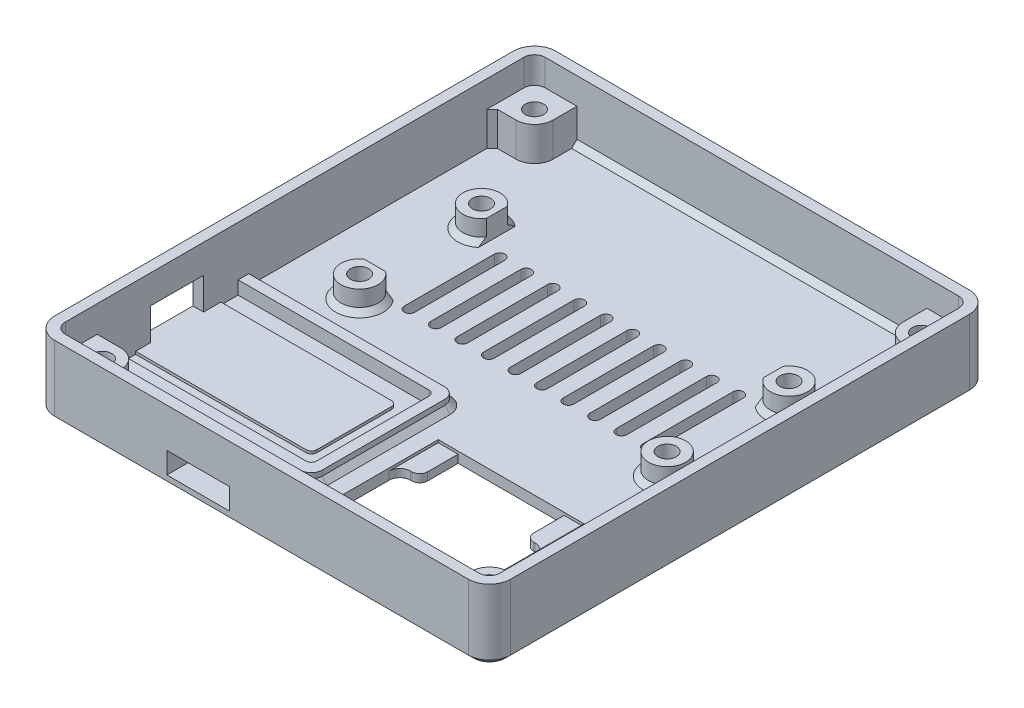
from build123d import *

# Parameters (mm, degrees)
BOSS_EXTRUDE1_DEPTH                               = 13.4
BOSS_EXTRUDE2_DEPTH                               = 2
SKETCH4_R                                         = 3.5
BOSS_EXTRUDE3_DEPTH                               = 4
CSK_FOR_4_FLAT_HEAD_SOCKET_CAP_SCREW1_D           = 3.4544
CSK_FOR_4_FLAT_HEAD_SOCKET_CAP_SCREW1_CSINK_D     = 6.7237356
CSK_FOR_4_FLAT_HEAD_SOCKET_CAP_SCREW1_CSINK_ANGLE = 82
BOSS_EXTRUDE5_DEPTH                               = 2
FILLET1_R                                         = 1
FILLET2_R                                         = 1
FILLET3_R                                         = 2
CUT_EXTRUDE4_REACH                                = 106.02
SKETCH16_W                                        = 10
SKETCH16_H                                        = 6
BOSS_EXTRUDE4_DEPTH                               = 6.4
CHAMFER1_SIZE                                     = 1
CHAMFER2_SIZE                                     = 1
CHAMFER3_SIZE                                     = 1
CUT_EXTRUDE2_REACH                                = 100.155
CUT_EXTRUDE6_DEPTH                                = 2
CUT_EXTRUDE6_DEPTH_BACK                           = 172.566325831
SKETCH19_W                                        = 11.8
SKETCH19_H                                        = 4
CUT_EXTRUDE8_DEPTH                                = 0.5
BOSS_EXTRUDE7_DEPTH                               = 2
CSK_FOR_4_FLAT_HEAD_SOCKET_CAP_SCREW2_D           = 3.4544
CSK_FOR_4_FLAT_HEAD_SOCKET_CAP_SCREW2_CSINK_D     = 6.723761
CSK_FOR_4_FLAT_HEAD_SOCKET_CAP_SCREW2_CSINK_ANGLE = 82
SKETCH26_W                                        = 27.5
SKETCH26_H                                        = 27.5
CUT_EXTRUDE9_DEPTH                                = 0.5
CUT_EXTRUDE10_DEPTH                               = 98.961449883


with BuildPart() as part:
    # Sketch2 → Boss-Extrude1 (new body)
    with BuildSketch(Plane(origin=(0, 0, 0), x_dir=(1, 0, 0), z_dir=(0, 1, 0))):
        with BuildLine():
            Line((-76.616981764, 30.627854819), (-76.616981764, -1.622145181))
            Line((-76.616981764, -1.622145181), (-76.616981764, -55.872145181))
            ThreePointArc((-76.616981764, -55.872145181), (-75.445408889, -58.700572306), (-72.616981764, -59.872145181))
            Line((-72.616981764, -59.872145181), (5.383018236, -59.872145181))
            ThreePointArc((5.383018236, -59.872145181), (8.211445361, -58.700572306), (9.383018236, -55.872145181))
            Line((9.383018236, -55.872145181), (9.383018236, -1.622145181))
            Line((9.383018236, -1.622145181), (9.383018236, 30.627854819))
            ThreePointArc((9.383018236, 30.627854819), (8.211445361, 33.456281944), (5.383018236, 34.627854819))
            Line((5.383018236, 34.627854819), (-72.616981764, 34.627854819))
            ThreePointArc((-72.616981764, 34.627854819), (-75.445408889, 33.456281944), (-76.616981764, 30.627854819))
        make_face()
        with BuildLine():
            Line((-74.616981764, -16.372145181), (-74.616981764, 13.627854819))
            Line((-74.616981764, 13.627854819), (-74.616981764, 30.627854819))
            ThreePointArc((-74.616981764, 30.627854819), (-74.031195326, 32.042068381), (-72.616981764, 32.627854819))
            Line((-72.616981764, 32.627854819), (5.383018236, 32.627854819))
            ThreePointArc((5.383018236, 32.627854819), (6.797231798, 32.042068381), (7.383018236, 30.627854819))
            Line((7.383018236, 30.627854819), (7.383018236, -55.872145181))
            ThreePointArc((7.383018236, -55.872145181), (6.797231798, -57.286358744), (5.383018236, -57.872145181))
            Line((5.383018236, -57.872145181), (-72.616981764, -57.872145181))
            ThreePointArc((-72.616981764, -57.872145181), (-74.031195326, -57.286358744), (-74.616981764, -55.872145181))
            Line((-74.616981764, -55.872145181), (-74.616981764, -16.372145181))
        make_face(mode=Mode.SUBTRACT)
    extrude(amount=BOSS_EXTRUDE1_DEPTH)

    # Sketch2<3> → Boss-Extrude2 (add)
    with BuildSketch(Plane(origin=(0, 0, 0), x_dir=(1, 0, 0), z_dir=(0, 1, 0))):
        with BuildLine():
            Line((-72.616981764, 32.627854819), (5.383018236, 32.627854819))
            ThreePointArc((5.383018236, 32.627854819), (6.797231798, 32.042068381), (7.383018236, 30.627854819))
            Line((7.383018236, 30.627854819), (7.383018236, -55.872145181))
            ThreePointArc((7.383018236, -55.872145181), (6.797231798, -57.286358744), (5.383018236, -57.872145181))
            Line((5.383018236, -57.872145181), (-72.616981764, -57.872145181))
            ThreePointArc((-72.616981764, -57.872145181), (-74.031195326, -57.286358744), (-74.616981764, -55.872145181))
            Line((-74.616981764, -55.872145181), (-74.616981764, 30.627854819))
            ThreePointArc((-74.616981764, 30.627854819), (-74.031195326, 32.042068381), (-72.616981764, 32.627854819))
        make_face()
    extrude(amount=BOSS_EXTRUDE2_DEPTH)

    # Sketch4 → Boss-Extrude3 (add)
    with BuildSketch(Plane(origin=(0, 2, 0), x_dir=(1, 0, 0), z_dir=(0, 1, 0))):
        with BuildLine():
            Line((-7.082532008, 11.986755501), (-7.082532008, 8.268954136))
            ThreePointArc((-7.082532008, 8.268954136), (-0.616981764, 10.127854819), (-7.082532008, 11.986755501))
        make_face()
        with BuildLine():
            Line((-59.234341769, 8.142814098), (-59.234341769, 12.112895539))
            ThreePointArc((-59.234341769, 12.112895539), (-63.156395065, 13.469952961), (-65.616981764, 10.127854819))
            ThreePointArc((-65.616981764, 10.127854819), (-63.156395065, 6.785756677), (-59.234341769, 8.142814098))
        make_face()
        with BuildLine():
            Line((-64.139653984, -10.015784368), (-60.094309544, -10.015784368))
            ThreePointArc((-60.094309544, -10.015784368), (-62.116981764, -16.372145181), (-64.139653984, -10.015784368))
        make_face()
        with Locations(Location((-4.116981764, -12.872145181, 0), (0, 0, 90))):
            Circle(SKETCH4_R)
    extrude(amount=BOSS_EXTRUDE3_DEPTH)

    # CSK for #4 Flat Head Socket Cap Screw1 (through all)
    with Locations(Plane(origin=(0, 0, 0), x_dir=(-1, 0, 0), z_dir=(0, -1, 0))):
        with Locations((4.116981764, 10.127854819), (62.116981764, 10.127854819), (4.116981764, -12.872145181), (62.116981764, -12.872145181)):
            CounterSinkHole(CSK_FOR_4_FLAT_HEAD_SOCKET_CAP_SCREW1_D / 2, CSK_FOR_4_FLAT_HEAD_SOCKET_CAP_SCREW1_CSINK_D / 2, counter_sink_angle=CSK_FOR_4_FLAT_HEAD_SOCKET_CAP_SCREW1_CSINK_ANGLE)

    # Sketch15 → Boss-Extrude5 (add)
    with BuildSketch(Plane(origin=(0, 2, 0), x_dir=(1, 0, 0), z_dir=(0, 1, 0))):
        Polygon((-74.616981764, -23.279023477), (-37.616981764, -23.279023477), (-37.616981764, -46.479023477), (-74.616981764, -46.479023477), (-74.616981764, -48.479023477), (-35.616981764, -48.479023477), (-35.616981764, -21.279023477), (-74.616981764, -21.279023477), align=None)
    extrude(amount=BOSS_EXTRUDE5_DEPTH)

    # Fillet1
    fillet1_edges = [part.edges().sort_by_distance(p)[0] for p in [
        (-37.616981764, 3, 23.279023477),
    ]]
    fillet(fillet1_edges, radius=FILLET1_R)

    # Fillet2
    fillet2_edges = [part.edges().sort_by_distance(p)[0] for p in [
        (-37.616981764, 3, 46.479023477),
    ]]
    fillet(fillet2_edges, radius=FILLET2_R)

    # Fillet3
    fillet3_edges = [part.edges().sort_by_distance(p)[0] for p in [
        (-35.616981764, 3, 48.479023477),
        (-35.616981764, 3, 21.279023477),
    ]]
    fillet(fillet3_edges, radius=FILLET3_R)

    # Sketch16 → Cut-Extrude4 (cut, up to next)
    with BuildSketch(Plane(origin=(-74.616981764, 0, 0), x_dir=(0, 0, -1), z_dir=(1, 0, 0)), mode=Mode.PRIVATE) as cut_extrude4_sk1:
        with Locations((-34.805263249, 5)):
            Rectangle(SKETCH16_W, SKETCH16_H)
    cut_extrude4_tool1 = extrude(cut_extrude4_sk1.sketch, amount=-CUT_EXTRUDE4_REACH, mode=Mode.PRIVATE) & part.part
    add(cut_extrude4_tool1.solids().sort_by_distance((-74.616982, 5, 34.805263))[0], mode=Mode.SUBTRACT)


with BuildPart() as boss_extrude4_tool:
    # Sketch9 → Boss-Extrude4 (new body)
    with BuildSketch(Plane(origin=(0, 2, 0), x_dir=(1, 0, 0), z_dir=(0, 1, 0))):
        with BuildLine():
            Line((2.883018236, -49.872145181), (7.383018236, -49.872145181))
            Line((7.383018236, -49.872145181), (7.383018236, -55.872145181))
            ThreePointArc((7.383018236, -55.872145181), (6.797231798, -57.286358744), (5.383018236, -57.872145181))
            Line((5.383018236, -57.872145181), (-0.616981764, -57.872145181))
            Line((-0.616981764, -57.872145181), (-0.616981764, -53.372145181))
            ThreePointArc((-0.616981764, -53.372145181), (0.408144502, -50.897271447), (2.883018236, -49.872145181))
        make_face()
        with BuildLine():
            Line((-0.616981764, 32.627854819), (5.383018236, 32.627854819))
            ThreePointArc((5.383018236, 32.627854819), (6.798375575, 32.040923679), (7.383015617, 30.624618423))
            Line((7.383015617, 30.624618423), (7.373311655, 24.627854819))
            Line((7.373311655, 24.627854819), (2.883018236, 24.627854819))
            ThreePointArc((2.883018236, 24.627854819), (0.408144502, 25.652981085), (-0.616981764, 28.127854819))
            Line((-0.616981764, 28.127854819), (-0.616981764, 32.627854819))
        make_face()
        with BuildLine():
            Line((-66.616981764, 32.627854819), (-72.616981764, 32.627854819))
            ThreePointArc((-72.616981764, 32.627854819), (-74.031195326, 32.042068381), (-74.616981764, 30.627854819))
            Line((-74.616981764, 30.627854819), (-74.616981764, 24.627854819))
            Line((-74.616981764, 24.627854819), (-70.116981764, 24.627854819))
            ThreePointArc((-70.116981764, 24.627854819), (-67.64210803, 25.652981085), (-66.616981764, 28.127854819))
            Line((-66.616981764, 28.127854819), (-66.616981764, 32.627854819))
        make_face()
        with BuildLine():
            Line((-66.616981764, -53.372145181), (-66.616981764, -57.872145181))
            Line((-66.616981764, -57.872145181), (-72.616981764, -57.872145181))
            ThreePointArc((-72.616981764, -57.872145181), (-74.032339103, -57.285214042), (-74.616979145, -55.868908785))
            Line((-74.616979145, -55.868908785), (-74.607275183, -49.872145181))
            Line((-74.607275183, -49.872145181), (-70.116981764, -49.872145181))
            ThreePointArc((-70.116981764, -49.872145181), (-67.64210803, -50.897271447), (-66.616981764, -53.372145181))
        make_face()
    extrude(amount=BOSS_EXTRUDE4_DEPTH)


with BuildPart() as part_1:
    add(part.part)


with BuildPart() as part_2:
    # Boss-Extrude4: joined with boss_extrude4_tool
    add(part_1.part.fuse(boss_extrude4_tool.part, tol=0.00001))

    # Chamfer1
    chamfer1_edges = [part_2.edges().sort_by_distance(p)[0] for p in [
        (-0.616981764, 5.2, 57.872145181),
        (7.383018236, 5.2, 49.872145181),
        (-74.616981764, 5.2, -24.627854819),
        (-66.616981764, 5.2, 57.872145181),
    ]]
    chamfer(chamfer1_edges, length=CHAMFER1_SIZE)

    # Chamfer2
    # the kernel refuses this chamfer: 1 mm, written as the material it adds along each edge
    with BuildSketch(Plane(origin=(-62.116981764, 2, 12.872145181), x_dir=(0.003141587485879022, 0, -0.9999950652018582), z_dir=(-0.9999950652018582, 0, -0.003141587485879022))) as chamfer2_piece_1_section:
        Polygon((3.5, -CHAMFER2_SIZE), (3.5 + CHAMFER2_SIZE, 0), (3.5, 0), align=None)
    chamfer2_piece_1 = revolve(axis=Axis((-62.116981764, 2, 12.872145181), (0, -1, 0)), revolution_arc=359.64, mode=Mode.PRIVATE)
    chamfer2_piece_1 = split(chamfer2_piece_1, bisect_by=Plane(origin=(-62.116981764, 2, 10.015784368), z_dir=(0, 0, 1)), keep=Keep.TOP, mode=Mode.PRIVATE)
    add(chamfer2_piece_1)
    with BuildSketch(Plane(origin=(-62.116981764, 2, -10.127854819), x_dir=(0.9999950652018582, 0, -0.0031415874858785257), z_dir=(0.0031415874858785257, 0, 0.9999950652018582))) as chamfer2_piece_2_section:
        Polygon((3.5, CHAMFER2_SIZE), (3.5 + CHAMFER2_SIZE, 0), (3.5, 0), align=None)
    chamfer2_piece_2 = revolve(axis=Axis((-62.116981764, 2, -10.127854819), (0, 1, 0)), revolution_arc=359.64, mode=Mode.PRIVATE)
    chamfer2_piece_2 = split(chamfer2_piece_2, bisect_by=Plane(origin=(-59.234341769, 2, -10.127854819), z_dir=(-1, 0, 0)), keep=Keep.TOP, mode=Mode.PRIVATE)
    add(chamfer2_piece_2)
    with BuildSketch(Plane(origin=(7.383018236, 2, -33.196301411), x_dir=(0, 1, 0), z_dir=(0, 0, 1))) as chamfer2_piece_3:
        Polygon((CHAMFER2_SIZE, 0), (0, CHAMFER2_SIZE), (0, 0), align=None)
    extrude(amount=84.64012958)
    with BuildSketch(Plane(origin=(-69.188664752, 2, -32.627854819), x_dir=(0, 1, 0), z_dir=(1, 0, 0))) as chamfer2_piece_4:
        Polygon((CHAMFER2_SIZE, 0), (0, CHAMFER2_SIZE), (0, 0), align=None)
    extrude(amount=71.143365976)
    with BuildSketch(Plane(origin=(0.954701224, 2, 57.872145181), x_dir=(0, 1, 0), z_dir=(-1, 0, 0))) as chamfer2_piece_5:
        Polygon((CHAMFER2_SIZE, 0), (0, CHAMFER2_SIZE), (0, 0), align=None)
    extrude(amount=69.143365976)
    with BuildSketch(Plane(origin=(-4.116981764, 2, -10.127854819), x_dir=(-0.9999950652018582, 0, 0.003141587485879529), z_dir=(-0.003141587485879529, 0, -0.9999950652018582))) as chamfer2_piece_6_section:
        Polygon((3.5, CHAMFER2_SIZE), (3.5 + CHAMFER2_SIZE, 0), (3.5, 0), align=None)
    chamfer2_piece_6 = revolve(axis=Axis((-4.116981764, 2, -10.127854819), (0, 1, 0)), revolution_arc=359.64, mode=Mode.PRIVATE)
    chamfer2_piece_6 = split(chamfer2_piece_6, bisect_by=Plane(origin=(-7.082532008, 2, -10.127854819), z_dir=(1, 0, 0)), keep=Keep.TOP, mode=Mode.PRIVATE)
    add(chamfer2_piece_6)
    with BuildSketch(Plane(origin=(-0.616981764, 2, 59.443828169), x_dir=(0, 1, 0), z_dir=(0, 0, -1)), Plane(origin=(2.883018236, 2, 49.872145181), x_dir=(0, 1, 0), z_dir=(1, 0, 0))) as chamfer2_piece_7:
        Polygon((CHAMFER2_SIZE, 0), (0, -CHAMFER2_SIZE), (0, 0), align=None)
    extrude(amount=6.071682988)
    with BuildSketch(Plane(origin=(2.883018236, 2, 53.372145181), x_dir=(-1, 0, 0), z_dir=(0, 0, 1))) as chamfer2_piece_8:
        Polygon((3.5, -CHAMFER2_SIZE), (3.5 + CHAMFER2_SIZE, 0), (3.5, 0), align=None)
    revolve(axis=Axis((2.883018236, 2, 53.372145181), (0, -1, 0)), revolution_arc=90)
    with BuildSketch(Plane(origin=(-4.116981764, 2, 12.872145181), x_dir=(0, 0, -1), z_dir=(1, 0, 0))) as chamfer2_piece_9:
        Polygon((3.5, CHAMFER2_SIZE), (3.5 + CHAMFER2_SIZE, 0), (3.5, 0), align=None)
    revolve(axis=Axis((-4.116981764, 2, 12.872145181), (0, 1, 0)))
    with BuildSketch(Plane(origin=(-77.188664752, 2, 48.479023477), x_dir=(0, 1, 0), z_dir=(1, 0, 0))) as chamfer2_piece_10_section:
        Polygon((CHAMFER2_SIZE, 0), (0, CHAMFER2_SIZE), (0, 0), align=None)
    chamfer2_piece_10 = extrude(amount=39.571682988, mode=Mode.PRIVATE)
    chamfer2_piece_10 = split(chamfer2_piece_10, bisect_by=Plane(origin=(-76.616981764, 2, 48.479023477), z_dir=(1, 0, 0)), keep=Keep.TOP, mode=Mode.PRIVATE)
    add(chamfer2_piece_10)
    with BuildSketch(Plane(origin=(-37.616981764, 2, 21.279023477), x_dir=(0, 1, 0), z_dir=(-1, 0, 0))) as chamfer2_piece_11_section:
        Polygon((CHAMFER2_SIZE, 0), (0, CHAMFER2_SIZE), (0, 0), align=None)
    chamfer2_piece_11 = extrude(amount=39.571682988, mode=Mode.PRIVATE)
    chamfer2_piece_11 = split(chamfer2_piece_11, bisect_by=Plane(origin=(-76.616981764, 2, 21.279023477), z_dir=(1, 0, 0)), keep=Keep.TOP, mode=Mode.PRIVATE)
    add(chamfer2_piece_11)
    with BuildSketch(Plane(origin=(-37.616981764, 2, 46.479023477), x_dir=(0, 0, 1), z_dir=(-1, 0, 0))) as chamfer2_piece_12:
        Polygon((2, CHAMFER2_SIZE), (2 + CHAMFER2_SIZE, 0), (2, 0), align=None)
    revolve(axis=Axis((-37.616981764, 2, 46.479023477), (0, 1, 0)), revolution_arc=90)
    with BuildSketch(Plane(origin=(-37.616981764, 2, 23.279023477), x_dir=(0, 0, -1), z_dir=(-1, 0, 0))) as chamfer2_piece_13:
        Polygon((2, -CHAMFER2_SIZE), (2 + CHAMFER2_SIZE, 0), (2, 0), align=None)
    revolve(axis=Axis((-37.616981764, 2, 23.279023477), (0, -1, 0)), revolution_arc=90)
    with BuildSketch(Plane(origin=(-35.616981764, 2, 46.479023477), x_dir=(0, 1, 0), z_dir=(0, 0, -1))) as chamfer2_piece_14:
        Polygon((CHAMFER2_SIZE, 0), (0, CHAMFER2_SIZE), (0, 0), align=None)
    extrude(amount=23.2)

    # Chamfer3
    chamfer3_edges = [part_2.edges().sort_by_distance(p)[0] for p in [
        (8.211445361, 0, 58.700572306),
        (-75.445408889, 0, 58.700572306),
        (8.211445361, 0, -33.456281944),
        (-76.616981764, 0, 12.622145181),
        (-75.445408889, 0, -33.456281944),
        (-33.616981764, 0, -34.627854819),
    ]]
    chamfer(chamfer3_edges, length=CHAMFER3_SIZE)

    # Sketch12 → Cut-Extrude2 (cut, up to next)
    with BuildSketch(Plane.XZ, mode=Mode.PRIVATE) as cut_extrude2_sk1:
        with BuildLine():
            Line((-54.660539895, 9.911346827), (-54.660539895, -7.088653173))
            ThreePointArc((-54.660539895, -7.088653173), (-55.660539895, -8.088653173), (-56.660539895, -7.088653173))
            Line((-56.660539895, -7.088653173), (-56.660539895, 9.911346827))
            ThreePointArc((-56.660539895, 9.911346827), (-55.660539895, 10.911346827), (-54.660539895, 9.911346827))
        make_face()
    cut_extrude2_tool1 = extrude(cut_extrude2_sk1.sketch, amount=-CUT_EXTRUDE2_REACH, mode=Mode.PRIVATE) & part_2.part
    # Sketch12 → Cut-Extrude2 (cut, up to next)
    with BuildSketch(Plane.XZ, mode=Mode.PRIVATE) as cut_extrude2_sk2:
        with BuildLine():
            Line((-49.660539895, 9.911346827), (-49.660539895, -7.088653173))
            ThreePointArc((-49.660539895, -7.088653173), (-50.660539895, -8.088653173), (-51.660539895, -7.088653173))
            Line((-51.660539895, -7.088653173), (-51.660539895, 9.911346827))
            ThreePointArc((-51.660539895, 9.911346827), (-50.660539895, 10.911346827), (-49.660539895, 9.911346827))
        make_face()
    cut_extrude2_tool2 = extrude(cut_extrude2_sk2.sketch, amount=-CUT_EXTRUDE2_REACH, mode=Mode.PRIVATE) & part_2.part
    # Sketch12 → Cut-Extrude2 (cut, up to next)
    with BuildSketch(Plane.XZ, mode=Mode.PRIVATE) as cut_extrude2_sk3:
        with BuildLine():
            Line((-44.660539895, 9.911346827), (-44.660539895, -7.088653173))
            ThreePointArc((-44.660539895, -7.088653173), (-45.660539895, -8.088653173), (-46.660539895, -7.088653173))
            Line((-46.660539895, -7.088653173), (-46.660539895, 9.911346827))
            ThreePointArc((-46.660539895, 9.911346827), (-45.660539895, 10.911346827), (-44.660539895, 9.911346827))
        make_face()
    cut_extrude2_tool3 = extrude(cut_extrude2_sk3.sketch, amount=-CUT_EXTRUDE2_REACH, mode=Mode.PRIVATE) & part_2.part
    # Sketch12 → Cut-Extrude2 (cut, up to next)
    with BuildSketch(Plane.XZ, mode=Mode.PRIVATE) as cut_extrude2_sk4:
        with BuildLine():
            Line((-39.660539895, 9.911346827), (-39.660539895, -7.088653173))
            ThreePointArc((-39.660539895, -7.088653173), (-40.660539895, -8.088653173), (-41.660539895, -7.088653173))
            Line((-41.660539895, -7.088653173), (-41.660539895, 9.911346827))
            ThreePointArc((-41.660539895, 9.911346827), (-40.660539895, 10.911346827), (-39.660539895, 9.911346827))
        make_face()
    cut_extrude2_tool4 = extrude(cut_extrude2_sk4.sketch, amount=-CUT_EXTRUDE2_REACH, mode=Mode.PRIVATE) & part_2.part
    # Sketch12 → Cut-Extrude2 (cut, up to next)
    with BuildSketch(Plane.XZ, mode=Mode.PRIVATE) as cut_extrude2_sk5:
        with BuildLine():
            Line((-34.660539895, 9.911346827), (-34.660539895, -7.088653173))
            ThreePointArc((-34.660539895, -7.088653173), (-35.660539895, -8.088653173), (-36.660539895, -7.088653173))
            Line((-36.660539895, -7.088653173), (-36.660539895, 9.911346827))
            ThreePointArc((-36.660539895, 9.911346827), (-35.660539895, 10.911346827), (-34.660539895, 9.911346827))
        make_face()
    cut_extrude2_tool5 = extrude(cut_extrude2_sk5.sketch, amount=-CUT_EXTRUDE2_REACH, mode=Mode.PRIVATE) & part_2.part
    # Sketch12 → Cut-Extrude2 (cut, up to next)
    with BuildSketch(Plane.XZ, mode=Mode.PRIVATE) as cut_extrude2_sk6:
        with BuildLine():
            Line((-29.660539895, 9.911346827), (-29.660539895, -7.088653173))
            ThreePointArc((-29.660539895, -7.088653173), (-30.660539895, -8.088653173), (-31.660539895, -7.088653173))
            Line((-31.660539895, -7.088653173), (-31.660539895, 9.911346827))
            ThreePointArc((-31.660539895, 9.911346827), (-30.660539895, 10.911346827), (-29.660539895, 9.911346827))
        make_face()
    cut_extrude2_tool6 = extrude(cut_extrude2_sk6.sketch, amount=-CUT_EXTRUDE2_REACH, mode=Mode.PRIVATE) & part_2.part
    # Sketch12 → Cut-Extrude2 (cut, up to next)
    with BuildSketch(Plane.XZ, mode=Mode.PRIVATE) as cut_extrude2_sk7:
        with BuildLine():
            Line((-24.660539895, 9.911346827), (-24.660539895, -7.088653173))
            ThreePointArc((-24.660539895, -7.088653173), (-25.660539895, -8.088653173), (-26.660539895, -7.088653173))
            Line((-26.660539895, -7.088653173), (-26.660539895, 9.911346827))
            ThreePointArc((-26.660539895, 9.911346827), (-25.660539895, 10.911346827), (-24.660539895, 9.911346827))
        make_face()
    cut_extrude2_tool7 = extrude(cut_extrude2_sk7.sketch, amount=-CUT_EXTRUDE2_REACH, mode=Mode.PRIVATE) & part_2.part
    # Sketch12 → Cut-Extrude2 (cut, up to next)
    with BuildSketch(Plane.XZ, mode=Mode.PRIVATE) as cut_extrude2_sk8:
        with BuildLine():
            Line((-19.660539895, 9.911346827), (-19.660539895, -7.088653173))
            ThreePointArc((-19.660539895, -7.088653173), (-20.660539895, -8.088653173), (-21.660539895, -7.088653173))
            Line((-21.660539895, -7.088653173), (-21.660539895, 9.911346827))
            ThreePointArc((-21.660539895, 9.911346827), (-20.660539895, 10.911346827), (-19.660539895, 9.911346827))
        make_face()
    cut_extrude2_tool8 = extrude(cut_extrude2_sk8.sketch, amount=-CUT_EXTRUDE2_REACH, mode=Mode.PRIVATE) & part_2.part
    # Sketch12 → Cut-Extrude2 (cut, up to next)
    with BuildSketch(Plane.XZ, mode=Mode.PRIVATE) as cut_extrude2_sk9:
        with BuildLine():
            Line((-14.660539895, 9.911346827), (-14.660539895, -7.088653173))
            ThreePointArc((-14.660539895, -7.088653173), (-15.660539895, -8.088653173), (-16.660539895, -7.088653173))
            Line((-16.660539895, -7.088653173), (-16.660539895, 9.911346827))
            ThreePointArc((-16.660539895, 9.911346827), (-15.660539895, 10.911346827), (-14.660539895, 9.911346827))
        make_face()
    cut_extrude2_tool9 = extrude(cut_extrude2_sk9.sketch, amount=-CUT_EXTRUDE2_REACH, mode=Mode.PRIVATE) & part_2.part
    # Sketch12 → Cut-Extrude2 (cut, up to next)
    with BuildSketch(Plane.XZ, mode=Mode.PRIVATE) as cut_extrude2_sk10:
        with BuildLine():
            Line((-9.660539895, 9.911346827), (-9.660539895, -7.088653173))
            ThreePointArc((-9.660539895, -7.088653173), (-10.660539895, -8.088653173), (-11.660539895, -7.088653173))
            Line((-11.660539895, -7.088653173), (-11.660539895, 9.911346827))
            ThreePointArc((-11.660539895, 9.911346827), (-10.660539895, 10.911346827), (-9.660539895, 9.911346827))
        make_face()
    cut_extrude2_tool10 = extrude(cut_extrude2_sk10.sketch, amount=-CUT_EXTRUDE2_REACH, mode=Mode.PRIVATE) & part_2.part
    add(cut_extrude2_tool1.solids().sort_by_distance((-55.66054, 0, 1.411347))[0], mode=Mode.SUBTRACT)
    add(cut_extrude2_tool2.solids().sort_by_distance((-50.66054, 0, 1.411347))[0], mode=Mode.SUBTRACT)
    add(cut_extrude2_tool3.solids().sort_by_distance((-45.66054, 0, 1.411347))[0], mode=Mode.SUBTRACT)
    add(cut_extrude2_tool4.solids().sort_by_distance((-40.66054, 0, 1.411347))[0], mode=Mode.SUBTRACT)
    add(cut_extrude2_tool5.solids().sort_by_distance((-35.66054, 0, 1.411347))[0], mode=Mode.SUBTRACT)
    add(cut_extrude2_tool6.solids().sort_by_distance((-30.66054, 0, 1.411347))[0], mode=Mode.SUBTRACT)
    add(cut_extrude2_tool7.solids().sort_by_distance((-25.66054, 0, 1.411347))[0], mode=Mode.SUBTRACT)
    add(cut_extrude2_tool8.solids().sort_by_distance((-20.66054, 0, 1.411347))[0], mode=Mode.SUBTRACT)
    add(cut_extrude2_tool9.solids().sort_by_distance((-15.66054, 0, 1.411347))[0], mode=Mode.SUBTRACT)
    add(cut_extrude2_tool10.solids().sort_by_distance((-10.66054, 0, 1.411347))[0], mode=Mode.SUBTRACT)

    # Sketch19 → Cut-Extrude6 (cut, two sides: drawn at the far end of the back side and taken through both)
    with BuildSketch(Plane(origin=(-134.489126945, 0, 57.872145181), x_dir=(-1, 0, 0), z_dir=(0, 0, -1)).offset(-CUT_EXTRUDE6_DEPTH_BACK)):
        with Locations((-88.92858705, 4)):
            Rectangle(SKETCH19_W, SKETCH19_H)
    extrude(amount=CUT_EXTRUDE6_DEPTH + CUT_EXTRUDE6_DEPTH_BACK, mode=Mode.SUBTRACT)

    # Sketch21 → Cut-Extrude8 (cut)
    with BuildSketch(Plane(origin=(0, 2, 0), x_dir=(1, 0, 0), z_dir=(0, 1, 0))):
        with BuildLine():
            Line((-74.616981764, -26.542143363), (-42.449625962, -26.542143363))
            ThreePointArc((-42.449625962, -26.542143363), (-41.742519181, -26.835036582), (-41.449625962, -27.542143363))
            Line((-41.449625962, -27.542143363), (-41.449625962, -41.619369379))
            ThreePointArc((-41.449625962, -41.619369379), (-41.742519181, -42.326476161), (-42.449625962, -42.619369379))
            Line((-42.449625962, -42.619369379), (-74.616981764, -42.619369379))
            Line((-74.616981764, -42.619369379), (-74.616981764, -46.405263249))
            Line((-74.616981764, -46.405263249), (-38.730294256, -46.405263249))
            ThreePointArc((-38.730294256, -46.405263249), (-38.023187475, -46.11237003), (-37.730294256, -45.405263249))
            Line((-37.730294256, -45.405263249), (-37.730294256, -24.279023477))
            ThreePointArc((-37.730294256, -24.279023477), (-38.023187475, -23.571916696), (-38.730294256, -23.279023477))
            Line((-38.730294256, -23.279023477), (-74.616981764, -23.279023477))
            Line((-74.616981764, -23.279023477), (-74.616981764, -26.542143363))
        make_face()
    extrude(amount=-CUT_EXTRUDE8_DEPTH, mode=Mode.SUBTRACT)

    # Sketch22 → Boss-Extrude7 (add)
    with BuildSketch(Plane(origin=(0, 0, 57.872145181), x_dir=(-1, 0, 0), z_dir=(0, 0, -1))):
        Polygon((38.160539895, 7.5), (38.160539895, 2), (39.660539895, 2), (39.660539895, 6), (51.460539895, 6), (51.460539895, 2), (52.960539895, 2), (52.960539895, 7.5), align=None)
    extrude(amount=BOSS_EXTRUDE7_DEPTH)

    # CSK for #4 Flat Head Socket Cap Screw2 (through all)
    with Locations(Plane(origin=(0, 0, 0), x_dir=(-1, 0, 0), z_dir=(0, -1, 0))):
        with Locations((70.116981764, -53.372145181), (-2.883018236, -53.372145181), (70.116981764, 28.127854819), (-2.883018236, 28.127854819)):
            CounterSinkHole(CSK_FOR_4_FLAT_HEAD_SOCKET_CAP_SCREW2_D / 2, CSK_FOR_4_FLAT_HEAD_SOCKET_CAP_SCREW2_CSINK_D / 2, counter_sink_angle=CSK_FOR_4_FLAT_HEAD_SOCKET_CAP_SCREW2_CSINK_ANGLE)

    # Sketch26 → Cut-Extrude9 (cut)
    with BuildSketch(Plane(origin=(0, 2, 0), x_dir=(1, 0, 0), z_dir=(0, 1, 0))):
        with Locations((-17.884873077, -42.261574955)):
            Rectangle(SKETCH26_W, SKETCH26_H)
    extrude(amount=-CUT_EXTRUDE9_DEPTH, mode=Mode.SUBTRACT)

    # Sketch27 → Cut-Extrude10 (cut, through all)
    with BuildSketch(Plane(origin=(0, 1.5, 0), x_dir=(1, 0, 0), z_dir=(0, 1, 0))):
        with BuildLine():
            Line((-27.884873077, -28.511574955), (-7.884873077, -28.511574955))
            Line((-7.884873077, -28.511574955), (-7.884873077, -34.261574955))
            ThreePointArc((-7.884873077, -34.261574955), (-7.445533248, -35.322235127), (-6.384873077, -35.761574955))
            Line((-6.384873077, -35.761574955), (-6.134873077, -35.761574955))
            ThreePointArc((-6.134873077, -35.761574955), (-4.720659514, -36.347361393), (-4.134873077, -37.761574955))
            Line((-4.134873077, -37.761574955), (-4.134873077, -46.761574955))
            ThreePointArc((-4.134873077, -46.761574955), (-4.720659514, -48.175788518), (-6.134873077, -48.761574955))
            Line((-6.134873077, -48.761574955), (-6.384873077, -48.761574955))
            ThreePointArc((-6.384873077, -48.761574955), (-7.445533248, -49.200914784), (-7.884873077, -50.261574955))
            Line((-7.884873077, -50.261574955), (-7.884873077, -56.011574955))
            Line((-7.884873077, -56.011574955), (-27.884873077, -56.011574955))
            Line((-27.884873077, -56.011574955), (-27.884873077, -50.261574955))
            ThreePointArc((-27.884873077, -50.261574955), (-28.324212905, -49.200914784), (-29.384873077, -48.761574955))
            Line((-29.384873077, -48.761574955), (-29.634873077, -48.761574955))
            ThreePointArc((-29.634873077, -48.761574955), (-31.049086639, -48.175788518), (-31.634873077, -46.761574955))
            Line((-31.634873077, -46.761574955), (-31.634873077, -37.761574955))
            ThreePointArc((-31.634873077, -37.761574955), (-31.049086639, -36.347361393), (-29.634873077, -35.761574955))
            Line((-29.634873077, -35.761574955), (-29.384873077, -35.761574955))
            ThreePointArc((-29.384873077, -35.761574955), (-28.324212905, -35.322235127), (-27.884873077, -34.261574955))
            Line((-27.884873077, -34.261574955), (-27.884873077, -28.511574955))
        make_face()
    extrude(amount=-CUT_EXTRUDE10_DEPTH, mode=Mode.SUBTRACT)


solid = part_2.part
